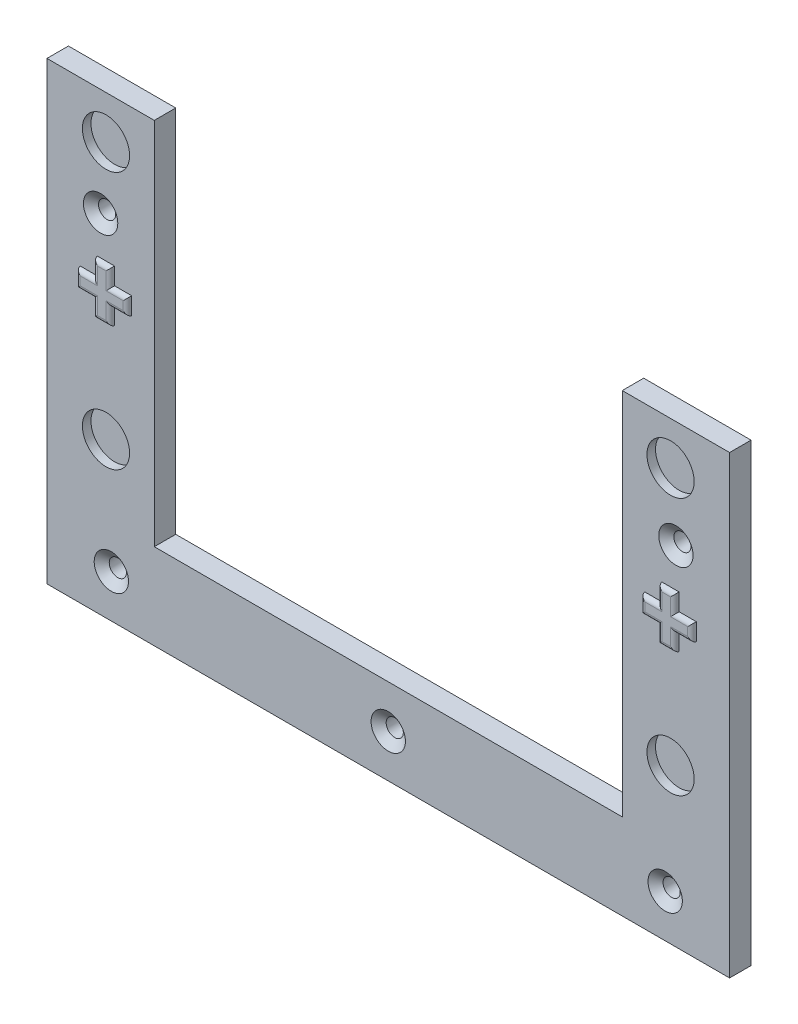
from build123d import *

# Parameters (mm, degrees)
ESQUISSE1_W             = 159
ESQUISSE1_H             = 106
BOSS_EXTRU_1_DEPTH      = 5
ENL_V_START             = -3
ESQUISSE3_R             = 5.5
ENL_V_MAT_EXTRU_2_DEPTH = 2.2
ESQUISSE4_W             = 109
ESQUISSE4_H             = 86
ENL_V_MAT_EXTRU_3_DEPTH = 6
ESQUISSE5_R             = 2
ENL_V_MAT_EXTRU_4_DEPTH = 6
CHANFREIN1_SIZE         = 2
CHANFREIN1_SIZE2        = 1.5071081
BOSS_EXTRU_2_START      = -5
BOSS_EXTRU_2_DEPTH      = 1
CONG_2_R                = 1


with BuildPart() as part:
    # Esquisse1 → Boss.-Extru.1 (new body)
    with BuildSketch(Plane.XY):
        with Locations((79.5, 53)):
            Rectangle(ESQUISSE1_W, ESQUISSE1_H)
    extrude(amount=BOSS_EXTRU_1_DEPTH)

    # Esquisse3 → Enlèv. mat.-Extru.2 (cut)
    with BuildSketch(Plane(origin=(0, 0, 0), x_dir=(-1, 0, 0), z_dir=(0, 0, -1)).offset(ENL_V_START)):
        with Locations((-13.75, 36)):
            Circle(ESQUISSE3_R)
        with Locations((-13.75, 96)):
            Circle(ESQUISSE3_R)
        with Locations((-145.25, 36)):
            Circle(ESQUISSE3_R)
        with Locations((-145.25, 96)):
            Circle(ESQUISSE3_R)
    extrude(amount=-ENL_V_MAT_EXTRU_2_DEPTH, mode=Mode.SUBTRACT)

    # Esquisse4 → Enlèv. mat.-Extru.3 (cut)
    with BuildSketch(Plane.XY.offset(5)):
        with Locations((79.5, 63)):
            Rectangle(ESQUISSE4_W, ESQUISSE4_H)
    extrude(amount=-ENL_V_MAT_EXTRU_3_DEPTH, mode=Mode.SUBTRACT)

    # Esquisse5 → Enlèv. mat.-Extru.4 (cut)
    with BuildSketch(Plane.XY.offset(5)):
        with Locations((15, 10)):
            Circle(ESQUISSE5_R)
        with Locations((144, 10)):
            Circle(ESQUISSE5_R)
        with Locations((12.5, 81)):
            Circle(ESQUISSE5_R)
        with Locations((146.5, 81)):
            Circle(ESQUISSE5_R)
        with Locations((79.5, 10)):
            Circle(ESQUISSE5_R)
    extrude(amount=-ENL_V_MAT_EXTRU_4_DEPTH, mode=Mode.SUBTRACT)

    # Chanfrein1
    chanfrein1_edges = [part.edges().sort_by_distance(p)[0] for p in [
        (13, 10, 5),
        (142, 10, 5),
        (10.5, 81, 5),
        (144.5, 81, 5),
        (77.5, 10, 5),
    ]]
    chanfrein1_side = [part.faces().sort_by_distance(p)[0] for p in [
        (1.910942176, 53, 5),
    ]]
    chamfer(chanfrein1_edges, length=CHANFREIN1_SIZE, length2=CHANFREIN1_SIZE2, reference=chanfrein1_side[0])

    # Esquisse2 → Boss.-Extru.2 (add)
    with BuildSketch(Plane(origin=(0, 0, 0), x_dir=(-1, 0, 0), z_dir=(0, 0, -1)).offset(BOSS_EXTRU_2_START)):
        Polygon((-11.75, 64), (-7.75, 64), (-7.75, 68), (-11.75, 68), (-11.75, 72), (-15.75, 72), (-15.75, 68), (-19.75, 68), (-19.75, 64), (-15.75, 64), (-15.75, 60), (-11.75, 60), align=None)
        Polygon((-143.25, 64), (-139.25, 64), (-139.25, 68), (-143.25, 68), (-143.25, 72), (-147.25, 72), (-147.25, 68), (-151.25, 68), (-151.25, 64), (-147.25, 64), (-147.25, 60), (-143.25, 60), align=None)
    extrude(amount=-BOSS_EXTRU_2_DEPTH)

    # Congé2
    cong_2_edges = [part.edges().sort_by_distance(p)[0] for p in [
        (11.75, 62, 6),
        (13.75, 60, 6),
        (15.75, 62, 6),
        (19.75, 66, 6),
        (17.75, 64, 6),
        (17.75, 68, 6),
        (15.75, 70, 6),
        (13.75, 72, 6),
        (11.75, 70, 6),
        (143.25, 70, 6),
        (145.25, 72, 6),
        (147.25, 70, 6),
        (149.25, 68, 6),
        (151.25, 66, 6),
        (149.25, 64, 6),
        (147.25, 62, 6),
        (145.25, 60, 6),
        (143.25, 62, 6),
        (141.25, 64, 6),
        (141.25, 68, 6),
        (139.25, 66, 6),
        (9.75, 68, 6),
        (7.75, 66, 6),
        (9.75, 64, 6),
    ]]
    fillet(cong_2_edges, radius=CONG_2_R - 0.0001)  # a hair under: the kernel refuses the full size


solid = part.part
